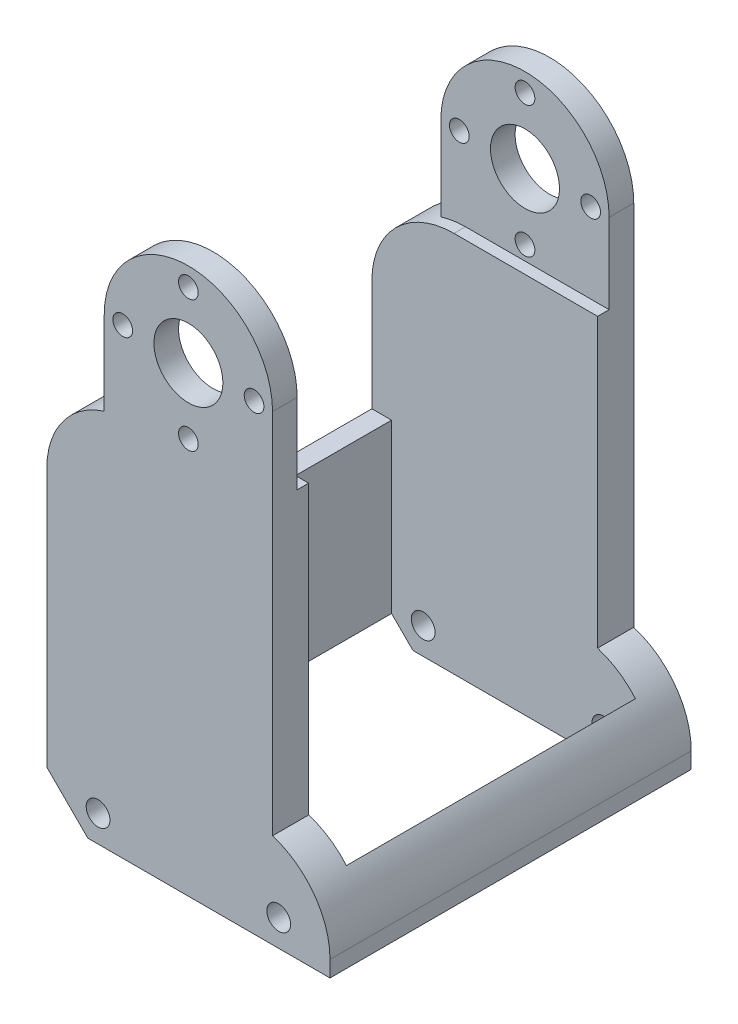
from build123d import *

# Parameters (mm, degrees)
BOSS_EXTRUDE1_DEPTH      = 22
BOSS_EXTRUDE1_DEPTH_BACK = 22
SKETCH2_W                = 38
SKETCH2_H                = 20
CUT_EXTRUDE1_DEPTH       = 105.423416914
SKETCH3_W                = 7
SKETCH3_H                = 44
BOSS_EXTRUDE2_DEPTH      = 65.5
SKETCH23_R               = 5
SKETCH23_R_2             = 1.2
CUT_EXTRUDE2_DEPTH       = 111.605436123
SKETCH24_W               = 28.5
SKETCH24_H               = 34
CUT_EXTRUDE3_DEPTH       = 90.954502389
SKETCH26_R               = 1.2
SKETCH26_R_2             = 5
SKETCH26_R_3             = 1.45
CUT_EXTRUDE6_DEPTH       = 107.330263801
SKETCH27_W               = 29.7
SKETCH27_H               = 35.2
CUT_EXTRUDE8_DEPTH       = 73.137455597
SKETCH29_W               = 7
SKETCH29_H               = 35
CUT_EXTRUDE10_DEPTH      = 74.468530678
CHAMFER2_SIZE            = 5
FILLET1_START            = -23
FILLET1_DEPTH            = 46
FILLET2_R                = 10
SKETCH30_W               = 35.2
SKETCH30_H               = 20
CUT_EXTRUDE12_DEPTH      = 10


with BuildPart() as part:
    # Sketch1 → Boss-Extrude1 (new, two sides: drawn at the far end of the back side and taken through both)
    with BuildSketch(Plane.XY.offset(-BOSS_EXTRUDE1_DEPTH_BACK)):
        with BuildLine():
            Line((10.25, -60), (10.25, 0))
            ThreePointArc((10.25, 0), (0, -10.25), (-10.25, 0))
            Line((-10.25, 0), (-10.25, -60))
            Line((-10.25, -60), (-10.25, -100))
            Line((-10.25, -100), (10.25, -100))
            Line((10.25, -100), (10.25, -60))
        make_face()
        with BuildLine():
            Line((10.25, 0), (9.2, 0))
            ThreePointArc((9.2, 0), (8.816088231, -0.879772698), (7.91, -1.196620241))
            ThreePointArc((7.91, -1.196620241), (5.656854249, -5.656854249), (1.196620241, -7.91))
            ThreePointArc((1.196620241, -7.91), (1.199154762, -7.954968281), (1.2, -8))
            ThreePointArc((1.2, -8), (-0.045031719, -9.199154762), (-1.196620241, -7.91))
            ThreePointArc((-1.196620241, -7.91), (-5.656854249, -5.656854249), (-7.91, -1.196620241))
            ThreePointArc((-7.91, -1.196620241), (-8.816088231, -0.879772698), (-9.2, 0))
            Line((-9.2, 0), (-10.25, 0))
            ThreePointArc((-10.25, 0), (0, -10.25), (10.25, 0))
        make_face()
        with BuildLine():
            ThreePointArc((7.91, -1.196620241), (7.120227302, -0.816088231), (6.8, 0))
            Line((6.8, 0), (4.2, 0))
            ThreePointArc((4.2, 0), (0, -4.2), (-4.2, 0))
            Line((-4.2, 0), (-6.8, 0))
            ThreePointArc((-6.8, 0), (-7.120227302, -0.816088231), (-7.91, -1.196620241))
            ThreePointArc((-7.91, -1.196620241), (-5.656854249, -5.656854249), (-1.196620241, -7.91))
            ThreePointArc((-1.196620241, -7.91), (0, -6.8), (1.196620241, -7.91))
            ThreePointArc((1.196620241, -7.91), (5.656854249, -5.656854249), (7.91, -1.196620241))
        make_face()
        with BuildLine():
            Line((4.2, 0), (6.8, 0))
            ThreePointArc((6.8, 0), (7.120227302, 0.816088231), (7.91, 1.196620241))
            ThreePointArc((7.91, 1.196620241), (5.656854249, 5.656854249), (1.196620241, 7.91))
            ThreePointArc((1.196620241, 7.91), (0, 6.8), (-1.196620241, 7.91))
            ThreePointArc((-1.196620241, 7.91), (-5.656854249, 5.656854249), (-7.91, 1.196620241))
            ThreePointArc((-7.91, 1.196620241), (-7.120227302, 0.816088231), (-6.8, 0))
            Line((-6.8, 0), (-4.2, 0))
            ThreePointArc((-4.2, 0), (0, 4.2), (4.2, 0))
        make_face()
        with BuildLine():
            ThreePointArc((7.91, 1.196620241), (8.816088231, 0.879772698), (9.2, 0))
            Line((9.2, 0), (10.25, 0))
            ThreePointArc((10.25, 0), (0, 10.25), (-10.25, 0))
            Line((-10.25, 0), (-9.2, 0))
            ThreePointArc((-9.2, 0), (-8.816088231, 0.879772698), (-7.91, 1.196620241))
            ThreePointArc((-7.91, 1.196620241), (-5.656854249, 5.656854249), (-1.196620241, 7.91))
            ThreePointArc((-1.196620241, 7.91), (-0.045031719, 9.199154762), (1.2, 8))
            ThreePointArc((1.2, 8), (1.199154762, 7.954968281), (1.196620241, 7.91))
            ThreePointArc((1.196620241, 7.91), (5.656854249, 5.656854249), (7.91, 1.196620241))
        make_face()
    extrude(amount=BOSS_EXTRUDE1_DEPTH + BOSS_EXTRUDE1_DEPTH_BACK)

    # Sketch2 → Cut-Extrude1 (cut, through all)
    with BuildSketch(Plane.ZY.offset(10.25)):
        with Locations((0, 0.25)):
            Rectangle(SKETCH2_W, SKETCH2_H)
    extrude(amount=-CUT_EXTRUDE1_DEPTH, mode=Mode.SUBTRACT)

    # Sketch3 → Boss-Extrude2 (add)
    with BuildSketch(Plane(origin=(0, -9.75, 0), x_dir=(1, 0, 0), z_dir=(0, 1, 0))):
        with Locations((-13.75, 0)):
            Rectangle(SKETCH3_W, SKETCH3_H)
        with Locations((13.75, 0)):
            Rectangle(SKETCH3_W, SKETCH3_H)
    extrude(amount=-BOSS_EXTRUDE2_DEPTH)

    # Sketch23 → Cut-Extrude2 (cut, through all)
    with BuildSketch(Plane.XY.offset(22)):
        with BuildLine():
            Line((-10.25, -100), (10.25, -100))
            Line((10.25, -100), (10.25, -85))
            ThreePointArc((10.25, -85), (0, -95.25), (-10.25, -85))
            Line((-10.25, -85), (-10.25, -100))
        make_face()
        with Locations((0, -85)):
            Circle(SKETCH23_R)
        with Locations((8, -85)):
            Circle(SKETCH23_R_2)
        with Locations((0, -77)):
            Circle(SKETCH23_R_2)
        with Locations((0, -93)):
            Circle(SKETCH23_R_2)
        with Locations((-8, -85)):
            Circle(SKETCH23_R_2)
    extrude(amount=-CUT_EXTRUDE2_DEPTH, mode=Mode.SUBTRACT)

    # Sketch24 → Cut-Extrude3 (cut, through all)
    with BuildSketch(Plane(origin=(0, -9.75, 0), x_dir=(1, 0, 0), z_dir=(0, 1, 0))):
        Rectangle(SKETCH24_W, SKETCH24_H)
    extrude(amount=-CUT_EXTRUDE3_DEPTH, mode=Mode.SUBTRACT)

    # Sketch26 → Cut-Extrude6 (cut, through all)
    # profile 1 of 5: a face of its own
    with BuildSketch(Plane.XY.offset(22)):
        with BuildLine():
            Line((10.25, -75.25), (14.25, -75.25))
            Line((14.25, -75.25), (14.25, -56.53282359))
            Line((14.25, -56.53282359), (14.25, -56.25))
            Line((14.25, -56.25), (-14.25, -56.25))
            Line((-14.25, -56.25), (-14.25, -56.53282359))
            Line((-14.25, -56.53282359), (-14.25, -75.25))
            Line((-14.25, -75.25), (-10.25, -75.25))
            Line((-10.25, -75.25), (-10.25, -85))
            ThreePointArc((-10.25, -85), (0, -95.25), (10.25, -85))
            Line((10.25, -85), (10.25, -75.25))
        make_face()
        with Locations((-8, -85)):
            Circle(SKETCH26_R, mode=Mode.SUBTRACT)
        with Locations((0, -85)):
            Circle(SKETCH26_R_2, mode=Mode.SUBTRACT)
        with Locations((0, -77)):
            Circle(SKETCH26_R, mode=Mode.SUBTRACT)
        with Locations((0, -93)):
            Circle(SKETCH26_R, mode=Mode.SUBTRACT)
        with Locations((8, -85)):
            Circle(SKETCH26_R, mode=Mode.SUBTRACT)
    # profile 2 of 5: a face of its own
    with BuildSketch(Plane.XY.offset(22)):
        Polygon((-17.25, -75.25), (-14.25, -75.25), (-14.25, -56.53282359), (-14.25, -56.25), (-17.25, -56.25), align=None)
    # profile 3 of 5: a face of its own
    with BuildSketch(Plane.XY.offset(22)):
        Polygon((14.25, -56.53282359), (14.25, -75.25), (17.25, -75.25), (17.25, -56.25), (14.25, -56.25), align=None)
    # profile 4 of 5: a face of its own
    with BuildSketch(Plane.XY.offset(22)):
        with Locations((-11, -53)):
            Circle(SKETCH26_R_3)
    # profile 5 of 5: a face of its own
    with BuildSketch(Plane.XY.offset(22)):
        with Locations((11, -53)):
            Circle(SKETCH26_R_3)
    extrude(amount=-CUT_EXTRUDE6_DEPTH, mode=Mode.SUBTRACT)

    # Sketch27 → Cut-Extrude8 (cut, through all)
    with BuildSketch(Plane.XZ.offset(56.25)):
        Rectangle(SKETCH27_W, SKETCH27_H)
    extrude(amount=-CUT_EXTRUDE8_DEPTH, mode=Mode.SUBTRACT)

    # Sketch29 → Cut-Extrude10 (cut, through all)
    with BuildSketch(Plane(origin=(0, 0, -22), x_dir=(-1, 0, 0), z_dir=(0, 0, -1))):
        with Locations((-13.75, -27.25)):
            Rectangle(SKETCH29_W, SKETCH29_H)
    extrude(amount=-CUT_EXTRUDE10_DEPTH, mode=Mode.SUBTRACT)

    # Chamfer2
    # the kernel refuses this chamfer: 5 mm, written as the material it takes off along each edge
    with BuildSketch(Plane(origin=(-17.25, -56.25, 34.85841494), x_dir=(1, 0, 0), z_dir=(0, 0, -1))) as chamfer2_piece_1:
        Polygon((CHAMFER2_SIZE, 0), (0, -CHAMFER2_SIZE), (0, 0), align=None)
    extrude(amount=69.71682988, mode=Mode.SUBTRACT)

    # Fillet1: read off the stored shape, not the designer's step
    # Fillet1 outline → Fillet1 (cut)
    with BuildSketch(Plane.XY.offset(FILLET1_START)):
        with BuildLine():
            ThreePointArc((10.25, -44.75), (15.312257748, -48.373312231), (17.25, -54.289392014))
            Line((17.25, -54.289392014), (17.25, -44.75))
            Line((17.25, -44.75), (10.25, -44.75))
        make_face()
    extrude(amount=FILLET1_DEPTH, mode=Mode.SUBTRACT)

    # Fillet2
    # the kernel refuses this fillet: 10 mm, written as the material it takes off along each edge
    with BuildSketch(Plane(origin=(-17.25, -9.75, -47), x_dir=(1, 0, 0), z_dir=(0, 0, 1))) as fillet2_piece_1_section:
        with BuildLine():
            CenterArc((FILLET2_R, -FILLET2_R), FILLET2_R, 90, 90)
            Line((0, -FILLET2_R), (0, 0))
            Line((0, 0), (FILLET2_R, 0))
        make_face()
    fillet2_piece_1 = extrude(amount=94, mode=Mode.PRIVATE)
    fillet2_piece_1 = split(fillet2_piece_1, bisect_by=Plane(origin=(-10.25, -9.75, -47), z_dir=(-1, 0, 0)), keep=Keep.TOP, mode=Mode.PRIVATE)
    add(fillet2_piece_1, mode=Mode.SUBTRACT)
    with BuildSketch(Plane(origin=(-17.25, -9.75, -47), x_dir=(1, 0, 0), z_dir=(0, 0, 1))) as fillet2_piece_2_section:
        with BuildLine():
            CenterArc((FILLET2_R, -FILLET2_R), FILLET2_R, 90, 90)
            Line((0, -FILLET2_R), (0, 0))
            Line((0, 0), (FILLET2_R, 0))
        make_face()
    fillet2_piece_2 = extrude(amount=94, mode=Mode.PRIVATE)
    fillet2_piece_2 = split(fillet2_piece_2, bisect_by=Plane(origin=(-17.25, -9.75, -19), z_dir=(0, 0, 1)), keep=Keep.TOP, mode=Mode.PRIVATE)
    fillet2_piece_2 = split(fillet2_piece_2, bisect_by=Plane(origin=(-17.25, -9.75, 19), z_dir=(0, 0, -1)), keep=Keep.TOP, mode=Mode.PRIVATE)
    add(fillet2_piece_2, mode=Mode.SUBTRACT)

    # Sketch30 → Cut-Extrude12 (cut)
    with BuildSketch(Plane.ZY.offset(17.25)):
        with Locations((0, -23.250769276)):
            Rectangle(SKETCH30_W, SKETCH30_H)
    extrude(amount=-CUT_EXTRUDE12_DEPTH, mode=Mode.SUBTRACT)


solid = part.part
